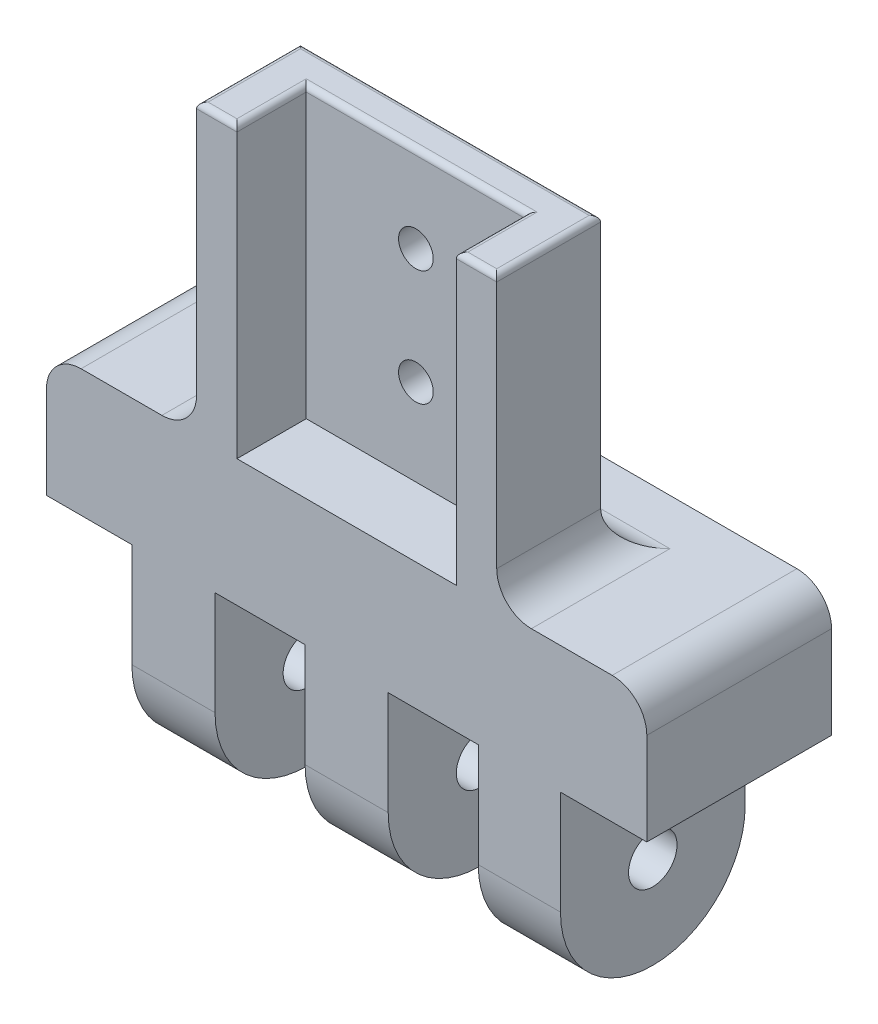
from build123d import *

# Parameters (mm, degrees)
SKETCH2_R           = 2.1
BOSS_EXTRUDE1_DEPTH = 26
SKETCH3_W           = 7.4
SKETCH3_H           = 18
SKETCH3_W_2         = 7.8
SKETCH3_W_3         = 7.481047655
CUT_EXTRUDE1_DEPTH  = 37.496575182
SKETCH4_W           = 26
SKETCH4_H           = 9
BOSS_EXTRUDE2_DEPTH = 25
SKETCH5_W           = 19
SKETCH5_H           = 6
CUT_EXTRUDE2_DEPTH  = 25
FILLET1_R           = 3
FILLET2_R           = 3
FILLET3_R           = 0.5
SKETCH6_R           = 1.5
CUT_EXTRUDE3_DEPTH  = 12.5


with BuildPart() as part:
    # Sketch2 → Boss-Extrude1 (new, symmetric)
    with BuildSketch(Plane(origin=(0, 0, 0), x_dir=(0, 0, -1), z_dir=(1, 0, 0))):
        with BuildLine():
            Line((-8, 0), (-8, 20))
            Line((-8, 20), (8, 20))
            Line((8, 20), (8, 0))
            ThreePointArc((8, 0), (0, -8), (-8, 0))
        make_face()
        Circle(SKETCH2_R, mode=Mode.SUBTRACT)
    extrude(amount=BOSS_EXTRUDE1_DEPTH, both=True)

    # Sketch3 → Cut-Extrude1 (cut, through all)
    with BuildSketch(Plane.XY.offset(8)):
        with Locations((-22.3, 0)):
            Rectangle(SKETCH3_W, SKETCH3_H)
        with Locations((-7.5, 0)):
            Rectangle(SKETCH3_W_2, SKETCH3_H)
        with Locations((7.5, 0)):
            Rectangle(SKETCH3_W_2, SKETCH3_H)
        with Locations((22.259476173, 0)):
            Rectangle(SKETCH3_W_3, SKETCH3_H)
    extrude(amount=-CUT_EXTRUDE1_DEPTH, mode=Mode.SUBTRACT)

    # Sketch4 → Boss-Extrude2 (add)
    with BuildSketch(Plane(origin=(0, 20, 0), x_dir=(1, 0, 0), z_dir=(0, 1, 0))):
        with Locations((0, -3.5)):
            Rectangle(SKETCH4_W, SKETCH4_H)
    extrude(amount=BOSS_EXTRUDE2_DEPTH)

    # Sketch5 → Cut-Extrude2 (cut)
    with BuildSketch(Plane(origin=(0, 45, 0), x_dir=(1, 0, 0), z_dir=(0, 1, 0))):
        with Locations((0, -5)):
            Rectangle(SKETCH5_W, SKETCH5_H)
    extrude(amount=-CUT_EXTRUDE2_DEPTH, mode=Mode.SUBTRACT)

    # Fillet1
    fillet1_edges = [part.edges().sort_by_distance(p)[0] for p in [
        (13, 20, 3.5),
        (0, 20, -1),
        (-13, 20, 3.5),
    ]]
    fillet(fillet1_edges, radius=FILLET1_R)

    # Fillet2
    fillet2_edges = [part.edges().sort_by_distance(p)[0] for p in [
        (26, 20, 0),
        (-26, 20, 0),
    ]]
    fillet(fillet2_edges, radius=FILLET2_R)

    # Fillet3
    fillet3_edges = [part.edges().sort_by_distance(p)[0] for p in [
        (13, 45, 3.5),
        (9.5, 45, 5),
        (11.25, 45, 8),
        (-11.25, 45, 8),
        (-9.5, 45, 5),
        (0, 45, 2),
        (0, 45, -1),
        (-13, 45, 3.5),
    ]]
    fillet(fillet3_edges, radius=FILLET3_R)

    # Sketch6 → Cut-Extrude3 (cut, symmetric)
    with BuildSketch(Plane.XY):
        with Locations((0, 37.5)):
            Circle(SKETCH6_R)
        with Locations((0, 27.5)):
            Circle(SKETCH6_R)
    extrude(amount=CUT_EXTRUDE3_DEPTH, both=True, mode=Mode.SUBTRACT)


solid = part.part
